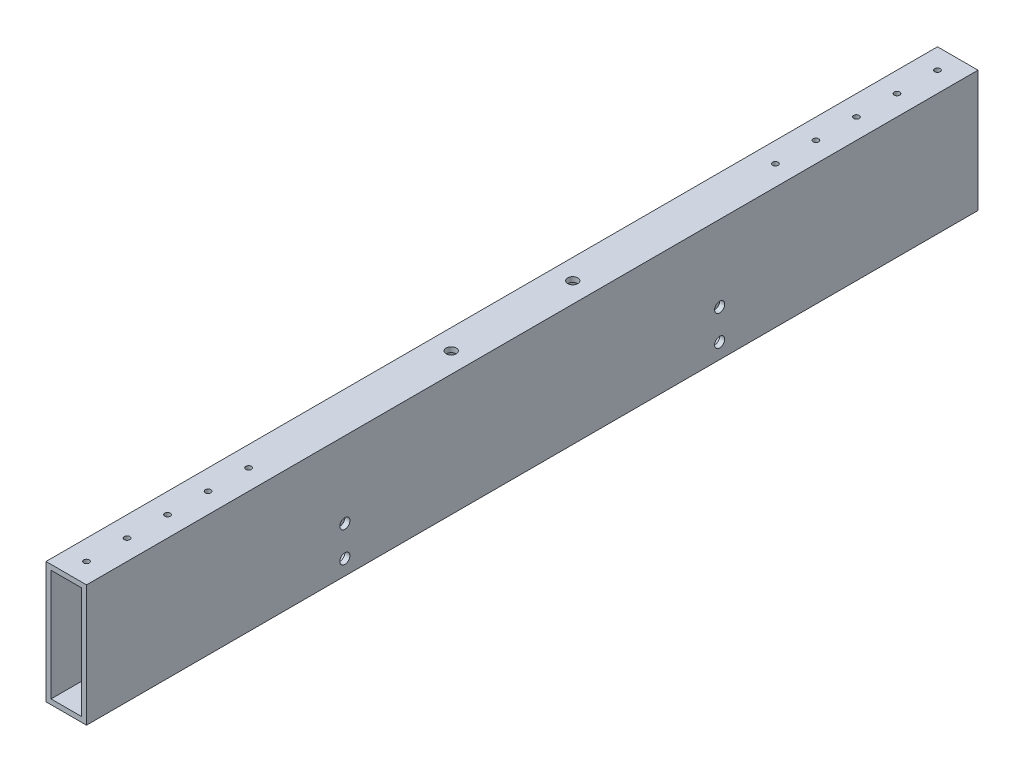
from build123d import *

# Parameters (mm, degrees)
SKETCH1_W                       = 25.4
SKETCH1_H                       = 76.2
SKETCH1_W_2                     = 19.05
SKETCH1_H_2                     = 69.85
BOSS_EXTRUDE1_DEPTH             = 279.4
SKETCH3_R                       = 1.7272
CUT_EXTRUDE2_DEPTH              = 6.35
F_1_4_0_25_DIAMETER_HOLE1_D     = 6.35
F_1_4_0_25_DIAMETER_HOLE1_DEPTH = 25.4
F_1_4_0_25_DIAMETER_HOLE1_TIP   = 1.907732465
F_1_4_0_25_DIAMETER_HOLE2_D     = 6.35
SKETCH2_R                       = 1.7272
CUT_EXTRUDE4_DEPTH              = 6.35


with BuildPart() as part:
    # Sketch1 → Boss-Extrude1 (new, symmetric)
    with BuildSketch(Plane.XY):
        Rectangle(SKETCH1_W, SKETCH1_H)
        Rectangle(SKETCH1_W_2, SKETCH1_H_2, mode=Mode.SUBTRACT)
    extrude(amount=BOSS_EXTRUDE1_DEPTH, both=True)

    # Sketch3 → Cut-Extrude2 (cut)
    with BuildSketch(Plane.XZ.offset(38.1)):
        with Locations((0, 254)):
            Circle(SKETCH3_R)
        with Locations((0, 203.2)):
            Circle(SKETCH3_R)
        with Locations((0, 152.4)):
            Circle(SKETCH3_R)
        with Locations((0, 101.6)):
            Circle(SKETCH3_R)
        with Locations((0, 50.8)):
            Circle(SKETCH3_R)
        Circle(SKETCH3_R)
        with Locations((0, -50.8)):
            Circle(SKETCH3_R)
        with Locations((0, -101.6)):
            Circle(SKETCH3_R)
        with Locations((0, -152.4)):
            Circle(SKETCH3_R)
        with Locations((0, -203.2)):
            Circle(SKETCH3_R)
        with Locations((0, -254)):
            Circle(SKETCH3_R)
    extrude(amount=-CUT_EXTRUDE2_DEPTH, mode=Mode.SUBTRACT)

    # 1/4 (0.25) Diameter Hole1
    with Locations(Plane.ZY.offset(12.7)):
        with Locations((-117.475, -28.575), (117.475, -28.575), (-117.475, -9.525), (117.475, -9.525)):
            Hole(F_1_4_0_25_DIAMETER_HOLE1_D / 2, depth=F_1_4_0_25_DIAMETER_HOLE1_DEPTH)
            with Locations((0, 0, -(F_1_4_0_25_DIAMETER_HOLE1_DEPTH + F_1_4_0_25_DIAMETER_HOLE1_TIP / 2))):  # 118° drill point
                Cone(0, F_1_4_0_25_DIAMETER_HOLE1_D / 2, F_1_4_0_25_DIAMETER_HOLE1_TIP, mode=Mode.SUBTRACT)

    # 1/4 (0.25) Diameter Hole2 (through all)
    with Locations(Plane(origin=(0, 38.1, 0), x_dir=(1, 0, 0), z_dir=(0, 1, 0))):
        with Locations((0, -38.1), (0, 38.1)):
            Hole(F_1_4_0_25_DIAMETER_HOLE2_D / 2)

    # Sketch2 → Cut-Extrude4 (cut)
    with BuildSketch(Plane(origin=(0, 38.1, 0), x_dir=(1, 0, 0), z_dir=(0, 1, 0))):
        with Locations((0, 266.7)):
            Circle(SKETCH2_R)
        with Locations((0, 241.3)):
            Circle(SKETCH2_R)
        with Locations((0, 215.9)):
            Circle(SKETCH2_R)
        with Locations((0, 190.5)):
            Circle(SKETCH2_R)
        with Locations((0, 165.1)):
            Circle(SKETCH2_R)
    cut_extrude4 = extrude(amount=-CUT_EXTRUDE4_DEPTH, mode=Mode.SUBTRACT)

    # Mirror1: Cut-Extrude4 across plane
    add(cut_extrude4.mirror(Plane.XY), mode=Mode.SUBTRACT)


solid = part.part
